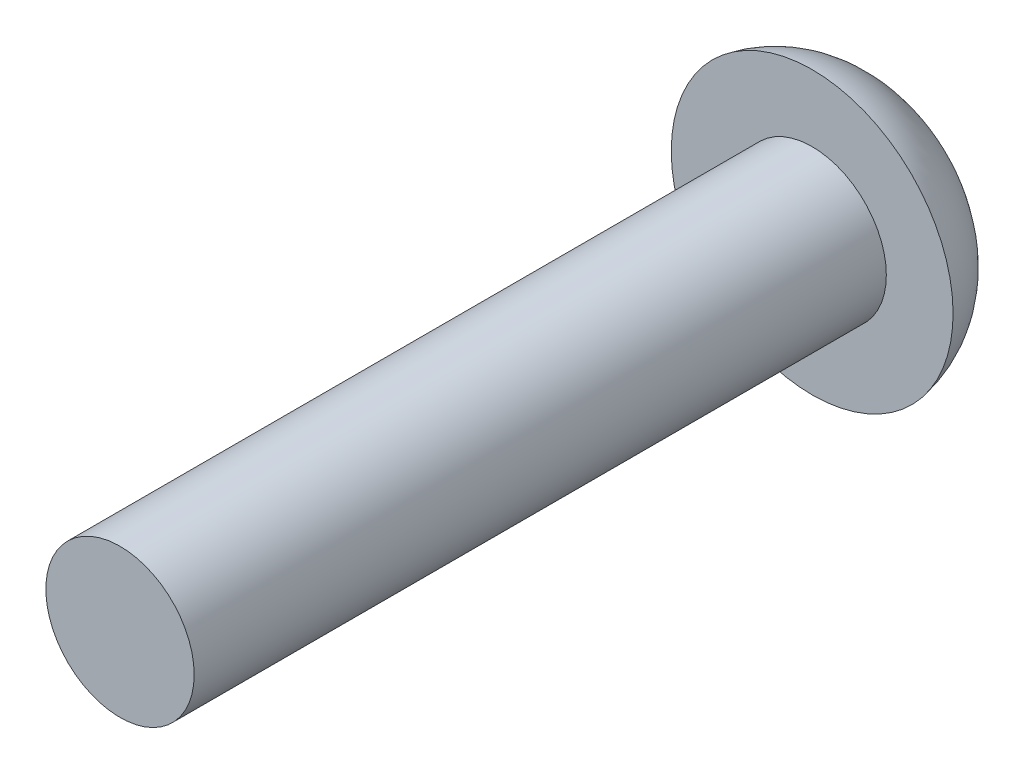
from build123d import *

# Parameters (mm, degrees)
SKETCH_1_R          = 1.5
EXTRUDE_1_DEPTH     = 14
SKETCH_2_R          = 2.85
EXTRUDE_2_DEPTH     = 1.65
FILLET_1_R          = 2
CUT_EXTRUDE_1_DEPTH = 0.5


with BuildPart() as part:
    # 草图1 → 凸台-拉伸1 (new body)
    with BuildSketch(Plane.XY):
        Circle(SKETCH_1_R)
    extrude(amount=EXTRUDE_1_DEPTH)

    # 草图2 → 凸台-拉伸2 (add)
    with BuildSketch(Plane(origin=(0, 0, 0), x_dir=(-1, 0, 0), z_dir=(0, 0, -1))):
        Circle(SKETCH_2_R)
    extrude(amount=EXTRUDE_2_DEPTH)

    # 圆角1
    # the kernel refuses this fillet: 2 mm, written as the material it takes off along each edge
    with BuildSketch(Plane(origin=(0, 0, -1.65), x_dir=(-1, 0, 0), z_dir=(0, -1, 0))) as fillet_1_piece_1:
        with BuildLine():
            CenterArc((0.880863133, -2), FILLET_1_R, 10.078658108, 79.921341892)
            Line((0.880863133, 0), (0.880863133, 0.04))
            Line((0.880863133, 0.04), (2.85, 0.04))
            Line((2.85, 0.04), (2.89, 0))
            ThreePointArc((2.89, 0), (2.89, -0.825), (2.889382737, -1.643))
            Line((2.889382737, -1.643), (2.85, -1.65))
        make_face()
    revolve(axis=Axis((0, 0, -1.65), (0, 0, -1)), mode=Mode.SUBTRACT)

    # 草图3 → 切除-拉伸1 (cut)
    with BuildSketch(Plane(origin=(0, 0, -1.65), x_dir=(-1, 0, 0), z_dir=(0, 0, -1))):
        Polygon((2.85, 0.25), (2.85, -0.25), (0.25, -0.25), (0.25, -2.85), (-0.25, -2.85), (-0.25, -0.25), (-2.85, -0.25), (-2.85, 0.25), (-0.25, 0.25), (-0.25, 2.85), (0.25, 2.85), (0.25, 0.25), align=None)
    extrude(amount=-CUT_EXTRUDE_1_DEPTH, mode=Mode.SUBTRACT)


solid = part.part
